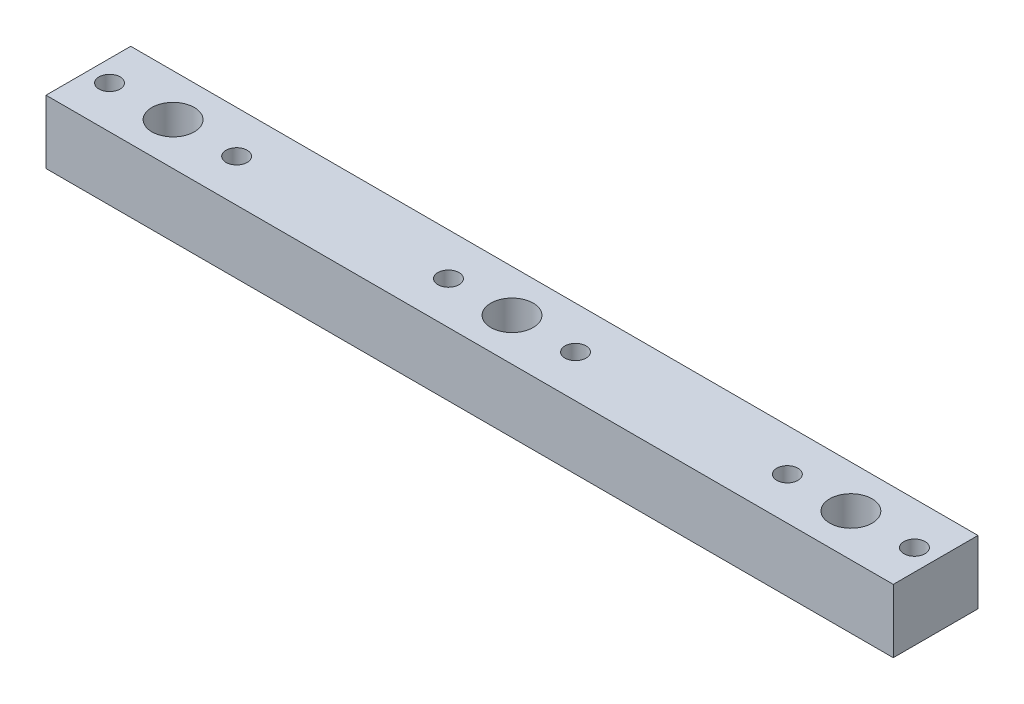
from build123d import *

# Parameters (mm, degrees)
SKETCH1_W           = 200
SKETCH1_H           = 20
SKETCH1_R           = 5
SKETCH1_R_2         = 2.5
BOSS_EXTRUDE1_DEPTH = 15


with BuildPart() as part:
    # Sketch1 → Boss-Extrude1 (new body)
    with BuildSketch(Plane(origin=(0, 0, 0), x_dir=(1, 0, 0), z_dir=(0, 1, 0))):
        with Locations((100, 10)):
            Rectangle(SKETCH1_W, SKETCH1_H)
        with Locations((20, 10)):
            Circle(SKETCH1_R, mode=Mode.SUBTRACT)
        with Locations((35, 10)):
            Circle(SKETCH1_R_2, mode=Mode.SUBTRACT)
        with Locations((5, 10)):
            Circle(SKETCH1_R_2, mode=Mode.SUBTRACT)
        with Locations((180, 10)):
            Circle(SKETCH1_R, mode=Mode.SUBTRACT)
        with Locations((195, 10)):
            Circle(SKETCH1_R_2, mode=Mode.SUBTRACT)
        with Locations((165, 10)):
            Circle(SKETCH1_R_2, mode=Mode.SUBTRACT)
        with Locations((100, 10)):
            Circle(SKETCH1_R, mode=Mode.SUBTRACT)
        with Locations((115, 10)):
            Circle(SKETCH1_R_2, mode=Mode.SUBTRACT)
        with Locations((85, 10)):
            Circle(SKETCH1_R_2, mode=Mode.SUBTRACT)
    extrude(amount=BOSS_EXTRUDE1_DEPTH)


solid = part.part
